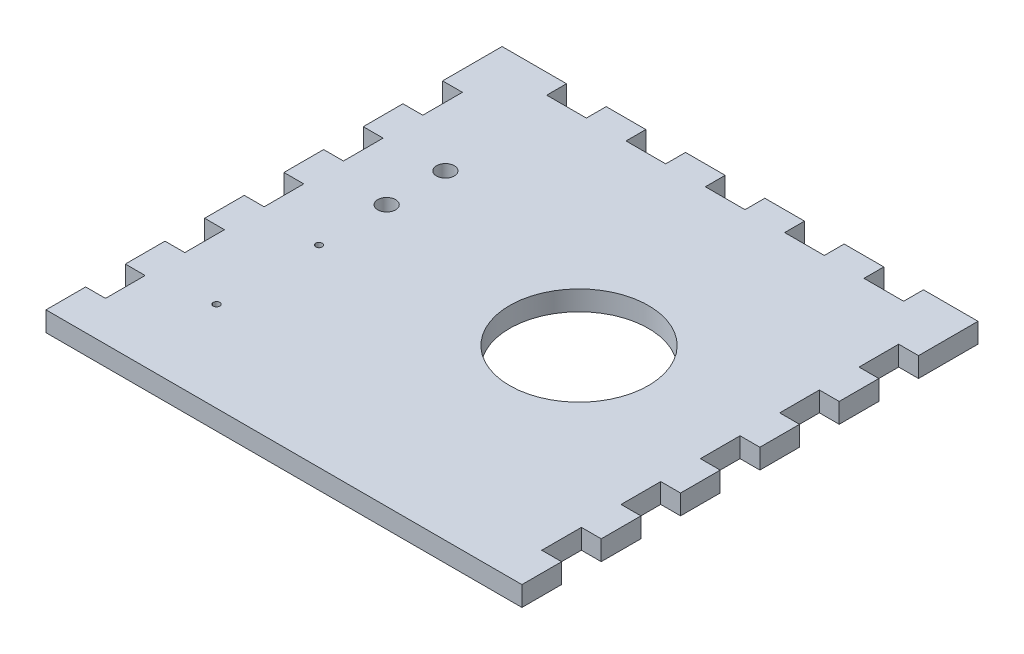
from build123d import *

# Parameters (mm, degrees)
SKETCH1_W               = 279.4
SKETCH1_H               = 279.4
BOSS_EXTRUDE1_DEPTH     = 12.7
SKETCH2_W               = 25.4
SKETCH2_H               = 12.7
BOSS_EXTRUDE2_DEPTH     = 12.7
LPATTERN1_COUNT         = 6
LPATTERN1_PITCH         = 50.8
MIRROR1_COPY_1_SKETCH_W = 25.4
MIRROR1_COPY_1_SKETCH_H = 12.7
MIRROR1_COPY_1_DEPTH    = 12.7
MIRROR1_COPY_2_SKETCH_W = 25.4
MIRROR1_COPY_2_SKETCH_H = 12.7
MIRROR1_COPY_2_DEPTH    = 12.7
MIRROR1_COPY_3_SKETCH_W = 25.4
MIRROR1_COPY_3_SKETCH_H = 12.7
MIRROR1_COPY_3_DEPTH    = 12.7
MIRROR1_COPY_4_SKETCH_W = 25.4
MIRROR1_COPY_4_SKETCH_H = 12.7
MIRROR1_COPY_4_DEPTH    = 12.7
MIRROR1_COPY_5_SKETCH_W = 25.4
MIRROR1_COPY_5_SKETCH_H = 12.7
MIRROR1_COPY_5_DEPTH    = 12.7
MIRROR1_COPY_6_SKETCH_W = 25.4
MIRROR1_COPY_6_SKETCH_H = 12.7
MIRROR1_COPY_6_DEPTH    = 12.7
SKETCH3_W               = 25.4
SKETCH3_H               = 12.7
BOSS_EXTRUDE3_DEPTH     = 12.7
LPATTERN2_COUNT         = 6
LPATTERN2_PITCH         = 50.8
SKETCH5_W               = 17.00363529
SKETCH5_H               = 12.7
BOSS_EXTRUDE4_DEPTH     = 12.7
SKETCH6_R               = 44.45
CUT_EXTRUDE1_DEPTH      = 216.9
SKETCH7_R               = 5.715
CUT_EXTRUDE2_DEPTH      = 216.9
SKETCH8_R               = 2.1
CUT_EXTRUDE3_DEPTH      = 216.9


with BuildPart() as part:
    # Sketch1 → Boss-Extrude1 (new body)
    with BuildSketch(Plane(origin=(0, 0, 0), x_dir=(1, 0, 0), z_dir=(0, 1, 0))):
        Rectangle(SKETCH1_W, SKETCH1_H)
    extrude(amount=BOSS_EXTRUDE1_DEPTH)

    # Sketch2 → Boss-Extrude2 (add)
    with BuildSketch(Plane(origin=(139.7, 0, 0), x_dir=(0, 0, -1), z_dir=(1, 0, 0))):
        with Locations((-127, 6.35)):
            Rectangle(SKETCH2_W, SKETCH2_H)
    boss_extrude2 = extrude(amount=BOSS_EXTRUDE2_DEPTH)

    # LPattern1: Boss-Extrude2 ×6
    with Locations(*[(0, 0, -i * LPATTERN1_PITCH) for i in range(1, LPATTERN1_COUNT)]):
        add(boss_extrude2)

    # Mirror1 copy 1 sketch → Mirror1 copy 1 (add)
    with BuildSketch(Plane(origin=(-139.7, 0, -50.8), x_dir=(0, 0, -1), z_dir=(-1, 0, 0))):
        with Locations((-127, -6.35)):
            Rectangle(MIRROR1_COPY_1_SKETCH_W, MIRROR1_COPY_1_SKETCH_H)
    extrude(amount=MIRROR1_COPY_1_DEPTH)

    # Mirror1 copy 2 sketch → Mirror1 copy 2 (add)
    with BuildSketch(Plane(origin=(-139.7, 0, -101.6), x_dir=(0, 0, -1), z_dir=(-1, 0, 0))):
        with Locations((-127, -6.35)):
            Rectangle(MIRROR1_COPY_2_SKETCH_W, MIRROR1_COPY_2_SKETCH_H)
    extrude(amount=MIRROR1_COPY_2_DEPTH)

    # Mirror1 copy 3 sketch → Mirror1 copy 3 (add)
    with BuildSketch(Plane(origin=(-139.7, 0, -152.4), x_dir=(0, 0, -1), z_dir=(-1, 0, 0))):
        with Locations((-127, -6.35)):
            Rectangle(MIRROR1_COPY_3_SKETCH_W, MIRROR1_COPY_3_SKETCH_H)
    extrude(amount=MIRROR1_COPY_3_DEPTH)

    # Mirror1 copy 4 sketch → Mirror1 copy 4 (add)
    with BuildSketch(Plane(origin=(-139.7, 0, -203.2), x_dir=(0, 0, -1), z_dir=(-1, 0, 0))):
        with Locations((-127, -6.35)):
            Rectangle(MIRROR1_COPY_4_SKETCH_W, MIRROR1_COPY_4_SKETCH_H)
    extrude(amount=MIRROR1_COPY_4_DEPTH)

    # Mirror1 copy 5 sketch → Mirror1 copy 5 (add)
    with BuildSketch(Plane(origin=(-139.7, 0, -254), x_dir=(0, 0, -1), z_dir=(-1, 0, 0))):
        with Locations((-127, -6.35)):
            Rectangle(MIRROR1_COPY_5_SKETCH_W, MIRROR1_COPY_5_SKETCH_H)
    extrude(amount=MIRROR1_COPY_5_DEPTH)

    # Mirror1 copy 6 sketch → Mirror1 copy 6 (add)
    with BuildSketch(Plane(origin=(-139.7, 0, 0), x_dir=(0, 0, -1), z_dir=(-1, 0, 0))):
        with Locations((-127, -6.35)):
            Rectangle(MIRROR1_COPY_6_SKETCH_W, MIRROR1_COPY_6_SKETCH_H)
    extrude(amount=MIRROR1_COPY_6_DEPTH)

    # Sketch3 → Boss-Extrude3 (add)
    with BuildSketch(Plane(origin=(0, 0, -139.7), x_dir=(-1, 0, 0), z_dir=(0, 0, -1))):
        with Locations((-130.175, 6.35)):
            Rectangle(SKETCH3_W, SKETCH3_H)
    boss_extrude3 = extrude(amount=BOSS_EXTRUDE3_DEPTH)

    # LPattern2: Boss-Extrude3 ×6
    with Locations(*[(-i * LPATTERN2_PITCH, 0, 0) for i in range(1, LPATTERN2_COUNT)]):
        add(boss_extrude3)

    # Sketch5 → Boss-Extrude4 (add)
    with BuildSketch(Plane(origin=(0, 0, -139.7), x_dir=(-1, 0, 0), z_dir=(0, 0, -1))):
        with Locations((-143.898182355, 6.35)):
            Rectangle(SKETCH5_W, SKETCH5_H)
    boss_extrude4 = extrude(amount=BOSS_EXTRUDE4_DEPTH)

    # Mirror2: Boss-Extrude4 across plane
    add(boss_extrude4.mirror(Plane(origin=(0, 0, 0), x_dir=(0, 0, 1), z_dir=(1, 0, 0))))

    # Sketch6 → Cut-Extrude1 (cut, through all)
    with BuildSketch(Plane(origin=(0, 12.7, 0), x_dir=(1, 0, 0), z_dir=(0, 1, 0))):
        with Locations((38.1, 11.176)):
            Circle(SKETCH6_R)
    extrude(amount=-CUT_EXTRUDE1_DEPTH, mode=Mode.SUBTRACT)

    # Sketch7 → Cut-Extrude2 (cut, through all)
    with BuildSketch(Plane(origin=(0, 12.7, 0), x_dir=(1, 0, 0), z_dir=(0, 1, 0))):
        with Locations((-101.6, 65.278)):
            Circle(SKETCH7_R)
        with Locations((-101.6, 27.686)):
            Circle(SKETCH7_R)
    extrude(amount=-CUT_EXTRUDE2_DEPTH, mode=Mode.SUBTRACT)

    # Sketch8 → Cut-Extrude3 (cut, through all)
    with BuildSketch(Plane(origin=(0, 12.7, 0), x_dir=(1, 0, 0), z_dir=(0, 1, 0))):
        with Locations((-100.9, -81.986081859)):
            Circle(SKETCH8_R)
        with Locations((-100.9, -16.378881859)):
            Circle(SKETCH8_R)
    extrude(amount=-CUT_EXTRUDE3_DEPTH, mode=Mode.SUBTRACT)


solid = part.part
